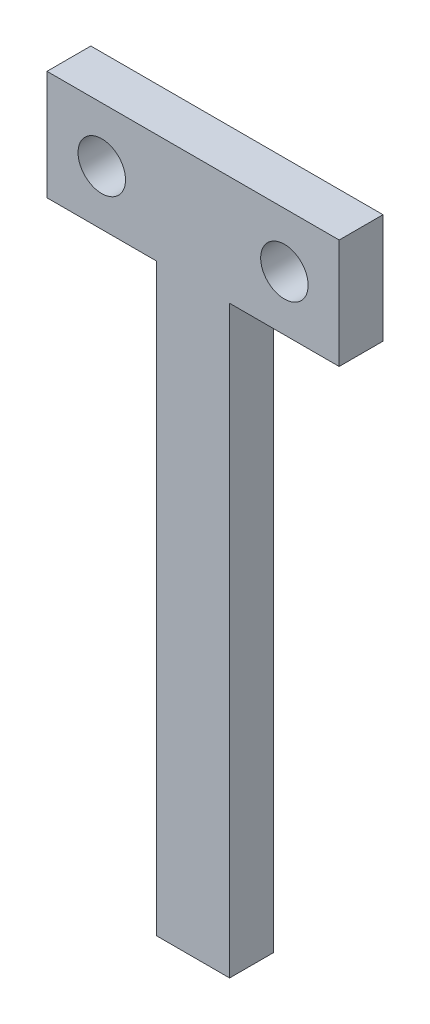
from build123d import *

# Parameters (mm, degrees)
SKETCH1_R           = 1.625
BOSS_EXTRUDE1_DEPTH = 3


with BuildPart() as part:
    # Sketch1 → Boss-Extrude1 (new body)
    with BuildSketch(Plane.XY):
        Polygon((0, 0), (0, 40), (-7.5, 40), (-7.5, 47.5), (12.5, 47.5), (12.5, 40), (5, 40), (5, 0), align=None)
        with Locations((-3.75, 43.75)):
            Circle(SKETCH1_R, mode=Mode.SUBTRACT)
        with Locations((8.75, 43.75)):
            Circle(SKETCH1_R, mode=Mode.SUBTRACT)
    extrude(amount=BOSS_EXTRUDE1_DEPTH)


solid = part.part
